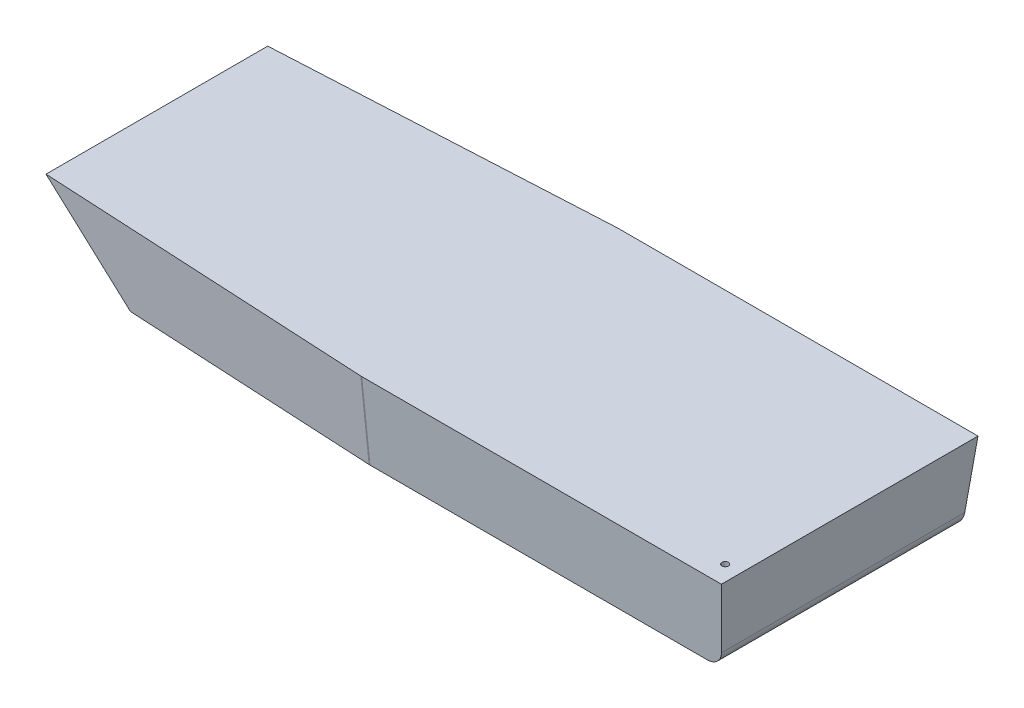
from build123d import *

# Parameters (mm, degrees)
LOFT_2_DEPTH             = 20
LOFT_2_DRAFT             = -5.7105931
CUT_EXTRUDE_8_DEPTH      = 176.915490387
CUT_EXTRUDE_8_DEPTH_BACK = 176.915490387
FILLET_1_R               = 4
SHELL_1_T                = 2
CUT_EXTRUDE_9_DEPTH      = 2
SKETCH_15_R              = 3.1
EXTRUDE_2_DEPTH          = 3.1
SKETCH_16_W              = 12.261336097
SKETCH_16_H              = 9.48947362
SKETCH_16_R              = 3.1
EXTRUDE_3_DEPTH          = 3.1
HOLE_WIZARD_M2_1_D       = 1.6
HOLE_WIZARD_M2_1_DEPTH   = 2


# Read off the part's stored shape, not the designer's step: 放样2
with BuildPart() as part:
    # 放样2 outline → 放样2 (with draft: the straight prism first)
    with BuildSketch(Plane(origin=(0, -20, 0), x_dir=(1, 0, 0), z_dir=(0, 1, 0))):
        Polygon((2, -25.602070867), (82.579718414, -29.825074964), (169.852914921, -29.825074964), (169.852914921, 29.825074964), (82.579718414, 29.825074964), (2, 25.602070867), align=None)
    extrude(amount=LOFT_2_DEPTH)
    # 放样2: the draft: its side faces are tilted about the plane it starts from
    loft_2_sides = [part.faces().sort_by_distance(p)[0] for p in [
        (42.289859207, -10, 27.713572915),
        (126.216316668, -10, 29.825074964),
        (169.852914921, -10, 0),
        (126.216316667, -10, -29.825074964),
        (42.289859207, -10, -27.713572915),
        (2, -10, 0),
    ]]
    draft(loft_2_sides, Plane(origin=(0, -20, 0), x_dir=(1, 0, 0), z_dir=(0, 1, 0)), LOFT_2_DRAFT)

    # 草图8 → 切除-拉伸8 (cut, two sides: drawn at the far end of the back side and taken through both)
    with BuildSketch(Plane.XY.offset(-CUT_EXTRUDE_8_DEPTH_BACK)):
        Polygon((0, 0), (20, -20), (-19.267413558, -20), align=None)
    extrude(amount=CUT_EXTRUDE_8_DEPTH + CUT_EXTRUDE_8_DEPTH_BACK, mode=Mode.SUBTRACT)

    # 圆角1
    # the kernel refuses this fillet: 4 mm, written as the material it takes off along each edge
    with BuildSketch(Plane(origin=(82.580397323, -20.25926479, -29.799148485), x_dir=(-0.9986397137740413, 0.0025926566839660006, 0.0520768682297623), z_dir=(-0.002605587720042804, 0.9950338125721717, -0.09950338059946291))) as fillet_1_piece_1:
        with BuildLine():
            CenterArc((FILLET_1_R * 0.0260558773727, FILLET_1_R), FILLET_1_R, 267.014891807, 2.985108193)
            Line((-FILLET_1_R * 0.0260205222495, FILLET_1_R * 0.00135689628257), (0, 0))
            Line((0, 0), (FILLET_1_R * 0.0260558773727, 0))
        make_face()
    extrude(amount=20.620937018, mode=Mode.SUBTRACT)
    with BuildSketch(Plane(origin=(82.580397323, -20.25926479, 29.799148485), x_dir=(-0.9986397137740393, 0.002592656683969708, -0.05207686822979932), z_dir=(-0.002605587720042804, 0.9950338125721717, 0.09950338059946291))) as fillet_1_piece_2:
        with BuildLine():
            CenterArc((FILLET_1_R * 0.0260558773727, -FILLET_1_R), FILLET_1_R, 90, 2.985108193)
            Line((-FILLET_1_R * 0.0260205222495, -FILLET_1_R * 0.00135689628257), (0, 0))
            Line((0, 0), (FILLET_1_R * 0.0260558773727, 0))
        make_face()
    extrude(amount=20.620937018, mode=Mode.SUBTRACT)
    with BuildSketch(Plane(origin=(169.852914921, -20, 38.874950591), x_dir=(-1, 0, 0), z_dir=(0, 0, -1))) as fillet_1_piece_3:
        with BuildLine():
            CenterArc((FILLET_1_R * 0.904987562707, FILLET_1_R), FILLET_1_R, 185.7105931, 84.2894069)
            Line((-FILLET_1_R * 0.0900496275678, FILLET_1_R * 0.90049628163), (0, 0))
            Line((0, 0), (FILLET_1_R * 0.904987562707, 0))
        make_face()
    extrude(amount=77.749901182, mode=Mode.SUBTRACT)

    # 抽壳1 (no face opened: a closed hollow body)
    add(offset(amount=-SHELL_1_T, mode=Mode.PRIVATE), mode=Mode.SUBTRACT)

    # 草图11 → 切除-拉伸9 (cut)
    with BuildSketch(Plane(origin=(0, -20, 0), x_dir=(1, 0, 0), z_dir=(0, 1, 0))):
        with BuildLine():
            Line((32.7540299, 23.458252391), (26.119793836, 7.804096994))
            ThreePointArc((26.119793836, 7.804096994), (24.534355196, 0), (26.119793836, -7.804096994))
            Line((26.119793836, -7.804096994), (32.7540299, -23.458252391))
            Line((32.7540299, -23.458252391), (82.6670403, -27.825074964))
            Line((82.6670403, -27.825074964), (159.58071917, -27.825074964))
            Line((159.58071917, -27.825074964), (159.58071917, 27.825074964))
            Line((159.58071917, 27.825074964), (82.6670403, 27.825074964))
            Line((82.6670403, 27.825074964), (32.7540299, 23.458252391))
        make_face()
    extrude(amount=CUT_EXTRUDE_9_DEPTH, mode=Mode.SUBTRACT)

    # 草图15 → 凸台-拉伸2 (add)
    with BuildSketch(Plane.XZ.offset(2)):
        Polygon((72.850599149, 29.104930146), (60.999300983, 28.483829928), (60.999300983, 20.617464002), (72.850599149, 20.617464002), align=None)
        with Locations(Location((67.061317629, 25.566411224, 0), (0, 0, 73.416746399))):
            Circle(SKETCH_15_R, mode=Mode.SUBTRACT)
    extrude_2 = extrude(amount=EXTRUDE_2_DEPTH)

    # 镜向1: 凸台-拉伸2 across plane
    add(extrude_2.mirror(Plane(origin=(0, 0, 0), x_dir=(1, 0, 0), z_dir=(0, 0, -1))))

    # 草图16 → 凸台-拉伸3 (add)
    with BuildSketch(Plane.XZ.offset(2)):
        with Locations((150.788762168, 25.613857156)):
            Rectangle(SKETCH_16_W, SKETCH_16_H)
        with Locations(Location((150.788762168, 25.939901438, 0), (0, 0, 90))):
            Circle(SKETCH_16_R, mode=Mode.SUBTRACT)
    extrude_3 = extrude(amount=EXTRUDE_3_DEPTH)

    # 镜向2: 凸台-拉伸3 across plane
    add(extrude_3.mirror(Plane(origin=(0, 0, 0), x_dir=(1, 0, 0), z_dir=(0, 0, -1))))

    # M2 螺纹孔1
    with Locations(Plane(origin=(0, 0, 0), x_dir=(1, 0, 0), z_dir=(0, 1, 0))):
        with Locations((168.015540482, -27.047622993)):
            Hole(HOLE_WIZARD_M2_1_D / 2, depth=HOLE_WIZARD_M2_1_DEPTH)


solid = part.part
